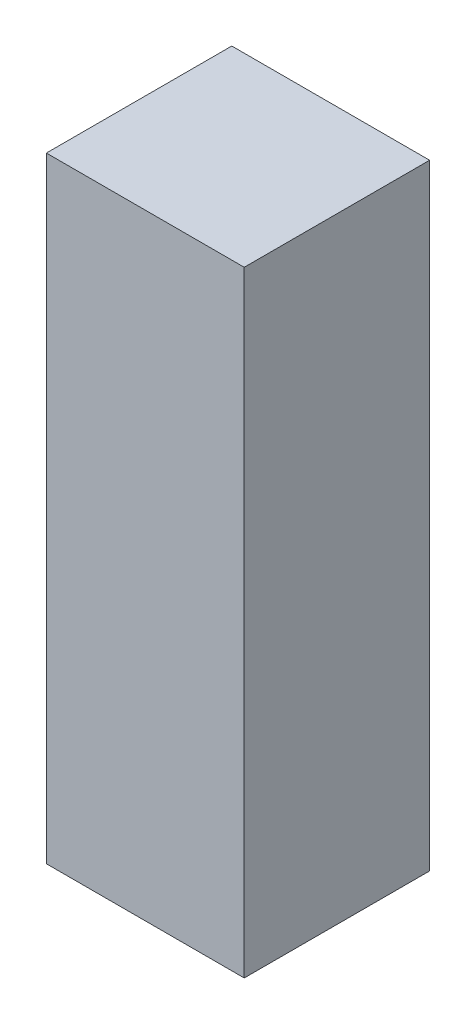
from build123d import *

# Parameters (mm, degrees)
SKETCH1_W           = 34.29
SKETCH1_H           = 32.131
BOSS_EXTRUDE1_DEPTH = 106.68


with BuildPart() as part:
    # Sketch1 → Boss-Extrude1 (new body)
    with BuildSketch(Plane(origin=(0, 0, 0), x_dir=(1, 0, 0), z_dir=(0, 1, 0))):
        with Locations((17.145, 16.0655)):
            Rectangle(SKETCH1_W, SKETCH1_H)
    extrude(amount=BOSS_EXTRUDE1_DEPTH)


solid = part.part
